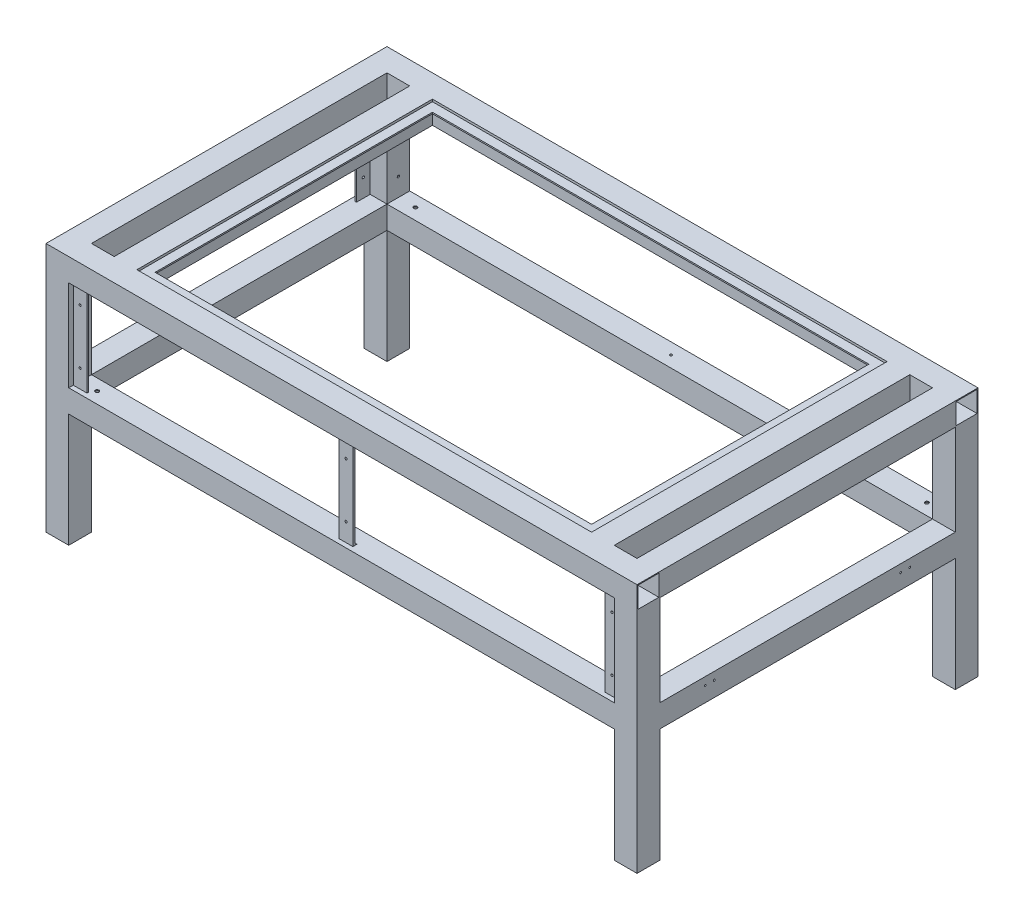
from build123d import *

# Parameters (mm, degrees)
ESQUISSE1_W                = 1300
ESQUISSE1_H                = 750
ESQUISSE1_W_2              = 1200
ESQUISSE1_H_2              = 650
BOSS_EXTRU_1_DEPTH         = 550
ESQUISSE2_W                = 1200
ESQUISSE2_H                = 200
ESQUISSE2_H_2              = 250
ENL_V_MAT_EXTRU_1_DEPTH    = 1599.436736315
ESQUISSE3_W                = 650
ESQUISSE3_H                = 200
ESQUISSE3_H_2              = 250
ENL_V_MAT_EXTRU_2_DEPTH    = 1599.436736315
ESQUISSE4_W                = 50
ESQUISSE4_H                = 650
BOSS_EXTRU_2_DEPTH         = 50
BOSS_EXTRU_2_2_DEPTH       = 50
ESQUISSE18_R               = 4
ENL_V_MAT_EXTRU_5_DEPTH    = 80
ESQUISSE19_R               = 15
ENL_V_MAT_EXTRU_6_DEPTH    = 48
ESQUISSE20_W               = 46
ESQUISSE20_H               = 46
ENL_V_MAT_EXTRU_7_DEPTH    = 10000
ESQUISSE21_W               = 46
ESQUISSE21_H               = 46
ENL_V_MAT_EXTRU_8_DEPTH    = 500
ESQUISSE22_W               = 30
ESQUISSE22_H               = 200
BOSS_EXTRU_11_DEPTH        = 3
ESQUISSE23_W               = 30
ESQUISSE23_H               = 200
ESQUISSE23_R               = 2.5
BOSS_EXTRU_12_DEPTH        = 3
ESQUISSE25_W               = 1000
ESQUISSE25_H               = 20
BOSS_EXTRU_14_DEPTH        = 3
ESQUISSE26_W               = 1000
ESQUISSE26_H               = 20
BOSS_EXTRU_15_DEPTH        = 3
ESQUISSE27_W               = 650
ESQUISSE27_H               = 20
BOSS_EXTRU_16_DEPTH        = 3
ESQUISSE28_W               = 20
ESQUISSE28_H               = 650
BOSS_EXTRU_17_DEPTH        = 3
ESQUISSE29_R               = 2.5
ENL_V_MAT_EXTRU_9_DEPTH    = 10
ESQUISSE30_R               = 2.5
ENL_V_MAT_EXTRU_10_DEPTH   = 15
ESQUISSE31_W               = 30
ESQUISSE31_H               = 5
BOSS_EXTRU_18_DEPTH        = 200
CONG_1_R                   = 5
ESQUISSE32_R               = 2.5
ENL_V_MAT_EXTRU_11_DEPTH   = 5
SYM_TRIE15_COPY_1_SKETCH_W = 30
SYM_TRIE15_COPY_1_SKETCH_H = 200
SYM_TRIE15_COPY_1_DEPTH    = 3
SYM_TRIE15_COPY_2_SKETCH_W = 30
SYM_TRIE15_COPY_2_SKETCH_H = 200
SYM_TRIE15_COPY_2_SKETCH_R = 2.5
SYM_TRIE15_COPY_2_DEPTH    = 3
SYM_TRIE15_COPY_3_SKETCH_W = 30
SYM_TRIE15_COPY_3_SKETCH_H = 200
SYM_TRIE15_COPY_3_DEPTH    = 3
SYM_TRIE15_COPY_4_SKETCH_W = 30
SYM_TRIE15_COPY_4_SKETCH_H = 200
SYM_TRIE15_COPY_4_SKETCH_R = 2.5
SYM_TRIE15_COPY_4_DEPTH    = 3
ESQUISSE33_W               = 80.648964208
ESQUISSE33_H               = 200
ENL_V_MAT_EXTRU_12_DEPTH   = 78
ESQUISSE34_R               = 2
ENL_V_MAT_EXTRU_13_DEPTH   = 25


with BuildPart() as part:
    # Esquisse1 → Boss.-Extru.1 (new body)
    with BuildSketch(Plane(origin=(0, 0, 0), x_dir=(1, 0, 0), z_dir=(0, 1, 0))):
        with Locations((650, 375)):
            Rectangle(ESQUISSE1_W, ESQUISSE1_H)
        with Locations((650, 375)):
            Rectangle(ESQUISSE1_W_2, ESQUISSE1_H_2, mode=Mode.SUBTRACT)
    extrude(amount=-BOSS_EXTRU_1_DEPTH)

    # Esquisse2 → Enlèv. mat.-Extru.1 (cut, through all)
    with BuildSketch(Plane.XY):
        with Locations((650, -150)):
            Rectangle(ESQUISSE2_W, ESQUISSE2_H)
        with Locations((650, -425)):
            Rectangle(ESQUISSE2_W, ESQUISSE2_H_2)
    extrude(amount=-ENL_V_MAT_EXTRU_1_DEPTH, mode=Mode.SUBTRACT)

    # Esquisse3 → Enlèv. mat.-Extru.2 (cut, through all)
    with BuildSketch(Plane.ZY):
        with Locations((-375, -150)):
            Rectangle(ESQUISSE3_W, ESQUISSE3_H)
        with Locations((-375, -425)):
            Rectangle(ESQUISSE3_W, ESQUISSE3_H_2)
    extrude(amount=-ENL_V_MAT_EXTRU_2_DEPTH, mode=Mode.SUBTRACT)

    # Esquisse18 → Enlèv. mat.-Extru.5 (cut)
    with BuildSketch(Plane(origin=(0, -250, 0), x_dir=(1, 0, 0), z_dir=(0, 1, 0))):
        with Locations((1212.5, 25)):
            Circle(ESQUISSE18_R)
        with Locations((87.5, 25)):
            Circle(ESQUISSE18_R)
        with Locations((87.5, 725)):
            Circle(ESQUISSE18_R)
        with Locations((1212.5, 725)):
            Circle(ESQUISSE18_R)
    extrude(amount=-ENL_V_MAT_EXTRU_5_DEPTH, mode=Mode.SUBTRACT)

    # Esquisse19 → Enlèv. mat.-Extru.6 (cut)
    with BuildSketch(Plane(origin=(0, -300, 0), x_dir=(-1, 0, 0), z_dir=(0, -1, 0))):
        with Locations((-1212.5, 725)):
            Circle(ESQUISSE19_R)
        with Locations((-87.5, 725)):
            Circle(ESQUISSE19_R)
        with Locations((-87.5, 25)):
            Circle(ESQUISSE19_R)
        with Locations((-1212.5, 25)):
            Circle(ESQUISSE19_R)
    extrude(amount=-ENL_V_MAT_EXTRU_6_DEPTH, mode=Mode.SUBTRACT)

    # Esquisse20 → Enlèv. mat.-Extru.7 (cut)
    with BuildSketch(Plane.ZY):
        with Locations((-25, -25)):
            Rectangle(ESQUISSE20_W, ESQUISSE20_H)
        with Locations((-725, -25)):
            Rectangle(ESQUISSE20_W, ESQUISSE20_H)
    extrude(amount=-ENL_V_MAT_EXTRU_7_DEPTH, mode=Mode.SUBTRACT)

    # Esquisse21 → Enlèv. mat.-Extru.8 (cut)
    with BuildSketch(Plane(origin=(0, -550, 0), x_dir=(-1, 0, 0), z_dir=(0, -1, 0))):
        with Locations((-1275, 25)):
            Rectangle(ESQUISSE21_W, ESQUISSE21_H)
        with Locations((-1275, 725)):
            Rectangle(ESQUISSE21_W, ESQUISSE21_H)
        with Locations((-25, 725)):
            Rectangle(ESQUISSE21_W, ESQUISSE21_H)
        with Locations((-25, 25)):
            Rectangle(ESQUISSE21_W, ESQUISSE21_H)
    extrude(amount=-ENL_V_MAT_EXTRU_8_DEPTH, mode=Mode.SUBTRACT)

    # Esquisse22 → Boss.-Extru.11 (add)
    with BuildSketch(Plane(origin=(0, 0, -50), x_dir=(-1, 0, 0), z_dir=(0, 0, -1))):
        with Locations((-25, -150)):
            Rectangle(ESQUISSE22_W, ESQUISSE22_H)
    boss_extru_11 = extrude(amount=BOSS_EXTRU_11_DEPTH)

    # Esquisse23 → Boss.-Extru.12 (add)
    with BuildSketch(Plane.ZY.offset(-10)):
        with Locations((-65, -150)):
            Rectangle(ESQUISSE23_W, ESQUISSE23_H)
        with Locations((-65, -90)):
            Circle(ESQUISSE23_R, mode=Mode.SUBTRACT)
        with Locations((-65, -210)):
            Circle(ESQUISSE23_R, mode=Mode.SUBTRACT)
    boss_extru_12 = extrude(amount=-BOSS_EXTRU_12_DEPTH)

    # Symétrie3: Boss.-Extru.11, Boss.-Extru.12 across plane
    add(boss_extru_11.mirror(Plane(origin=(0, 0, 0), x_dir=(-0.7071067811865475, 0, 0.7071067811865477), z_dir=(-0.7071067811865476, 0, -0.7071067811865475))))
    add(boss_extru_12.mirror(Plane(origin=(0, 0, 0), x_dir=(-0.7071067811865475, 0, 0.7071067811865477), z_dir=(-0.7071067811865476, 0, -0.7071067811865475))))



with BuildPart() as body_2:
    # Esquisse4 → Boss.-Extru.2 (new body)
    with BuildSketch(Plane(origin=(0, 0, 0), x_dir=(1, 0, 0), z_dir=(0, 1, 0))):
        with Locations((125, 375)):
            Rectangle(ESQUISSE4_W, ESQUISSE4_H)
    extrude(amount=-BOSS_EXTRU_2_DEPTH)


with BuildPart() as body_3:
    # Esquisse4 → Boss.-Extru.2 2 (new body)
    with BuildSketch(Plane(origin=(0, 0, 0), x_dir=(1, 0, 0), z_dir=(0, 1, 0))):
        with Locations((1175, 375)):
            Rectangle(ESQUISSE4_W, ESQUISSE4_H)
    extrude(amount=-BOSS_EXTRU_2_2_DEPTH)


with BuildPart() as part_1:
    add(part.part)

    add(body_2.part)  # Boss.-Extru.14 merges body 2

    add(body_3.part)  # Boss.-Extru.14 merges body 3
    # Esquisse25 → Boss.-Extru.14 (add)
    with BuildSketch(Plane(origin=(0, 0, -50), x_dir=(-1, 0, 0), z_dir=(0, 0, -1))):
        with Locations((-650, -15)):
            Rectangle(ESQUISSE25_W, ESQUISSE25_H)
    boss_extru_14 = extrude(amount=BOSS_EXTRU_14_DEPTH)

    # Esquisse26 → Boss.-Extru.15 (add)
    with BuildSketch(Plane(origin=(0, -5, 0), x_dir=(1, 0, 0), z_dir=(0, 1, 0))):
        with Locations((650, 60)):
            Rectangle(ESQUISSE26_W, ESQUISSE26_H)
    boss_extru_15 = extrude(amount=-BOSS_EXTRU_15_DEPTH)

    # Symétrie6: Boss.-Extru.14, Boss.-Extru.15 across plane
    add(boss_extru_14.mirror(Plane.XY.offset(-375)))
    add(boss_extru_15.mirror(Plane.XY.offset(-375)))

    # Esquisse27 → Boss.-Extru.16 (add)
    with BuildSketch(Plane.ZY.offset(-1150)):
        with Locations((-375, -15)):
            Rectangle(ESQUISSE27_W, ESQUISSE27_H)
    boss_extru_16 = extrude(amount=BOSS_EXTRU_16_DEPTH)

    # Esquisse28 → Boss.-Extru.17 (add)
    with BuildSketch(Plane(origin=(0, -5, 0), x_dir=(1, 0, 0), z_dir=(0, 1, 0))):
        with Locations((1140, 375)):
            Rectangle(ESQUISSE28_W, ESQUISSE28_H)
    boss_extru_17 = extrude(amount=-BOSS_EXTRU_17_DEPTH)

    # Symétrie7: Boss.-Extru.16, Boss.-Extru.17 across plane
    add(boss_extru_16.mirror(Plane.ZY.offset(-650)))
    add(boss_extru_17.mirror(Plane.ZY.offset(-650)))

    # Esquisse29 → Enlèv. mat.-Extru.9 (cut)
    with BuildSketch(Plane.ZY.offset(-1250)):
        with Locations((-725, -210)):
            Circle(ESQUISSE29_R)
        with Locations((-725, -90)):
            Circle(ESQUISSE29_R)
    enl_v_mat_extru_9 = extrude(amount=-ENL_V_MAT_EXTRU_9_DEPTH, mode=Mode.SUBTRACT)

    # Symétrie9: Enlèv. mat.-Extru.9 across plane
    add(enl_v_mat_extru_9.mirror(Plane.ZY.offset(-650)), mode=Mode.SUBTRACT)

    # Esquisse30 → Enlèv. mat.-Extru.10 (cut)
    with BuildSketch(Plane(origin=(0, -250, 0), x_dir=(1, 0, 0), z_dir=(0, 1, 0))):
        with Locations((650, 725)):
            Circle(ESQUISSE30_R)
    enl_v_mat_extru_10 = extrude(amount=-ENL_V_MAT_EXTRU_10_DEPTH, mode=Mode.SUBTRACT)

    # Symétrie10: Enlèv. mat.-Extru.10 across plane
    add(enl_v_mat_extru_10.mirror(Plane(origin=(0, -150, 0), x_dir=(0, 0, 1), z_dir=(0, -1, 0))), mode=Mode.SUBTRACT)

    # Esquisse31 → Boss.-Extru.18 (add)
    with BuildSketch(Plane(origin=(0, -250, 0), x_dir=(1, 0, 0), z_dir=(0, 1, 0))):
        with Locations((650, 12.5)):
            Rectangle(ESQUISSE31_W, ESQUISSE31_H)
    extrude(amount=BOSS_EXTRU_18_DEPTH)

    # Congé1
    cong_1_edges = [part_1.edges().sort_by_distance(p)[0] for p in [
        (650, -250, -15),
        (650, -50, -15),
    ]]
    fillet(cong_1_edges, radius=CONG_1_R)

    # Esquisse32 → Enlèv. mat.-Extru.11 (cut)
    with BuildSketch(Plane.XY.offset(-10)):
        with Locations((650, -210)):
            Circle(ESQUISSE32_R)
        with Locations((650, -90)):
            Circle(ESQUISSE32_R)
    extrude(amount=-ENL_V_MAT_EXTRU_11_DEPTH, mode=Mode.SUBTRACT)

    # Symétrie11: Boss.-Extru.12 across plane
    add(boss_extru_12.mirror(Plane.XY.offset(-375)))

    # Symétrie15 copy 1 sketch → Symétrie15 copy 1 (add)
    with BuildSketch(Plane.ZY.offset(-1250)):
        with Locations((-25, -150)):
            Rectangle(SYM_TRIE15_COPY_1_SKETCH_W, SYM_TRIE15_COPY_1_SKETCH_H)
    extrude(amount=SYM_TRIE15_COPY_1_DEPTH)

    # Symétrie15 copy 2 sketch → Symétrie15 copy 2 (add)
    with BuildSketch(Plane(origin=(1300, 0, -10), x_dir=(1, 0, 0), z_dir=(0, 0, 1))):
        with Locations((-65, -150)):
            Rectangle(SYM_TRIE15_COPY_2_SKETCH_W, SYM_TRIE15_COPY_2_SKETCH_H)
        with Locations((-65, -90)):
            Circle(SYM_TRIE15_COPY_2_SKETCH_R, mode=Mode.SUBTRACT)
        with Locations((-65, -210)):
            Circle(SYM_TRIE15_COPY_2_SKETCH_R, mode=Mode.SUBTRACT)
    extrude(amount=-SYM_TRIE15_COPY_2_DEPTH)

    # Symétrie15 copy 3 sketch → Symétrie15 copy 3 (add)
    with BuildSketch(Plane(origin=(1300, 0, -50), x_dir=(1, 0, 0), z_dir=(0, 0, -1))):
        with Locations((-25, 150)):
            Rectangle(SYM_TRIE15_COPY_3_SKETCH_W, SYM_TRIE15_COPY_3_SKETCH_H)
    extrude(amount=SYM_TRIE15_COPY_3_DEPTH)

    # Symétrie15 copy 4 sketch → Symétrie15 copy 4 (add)
    with BuildSketch(Plane(origin=(1290, 0, 0), x_dir=(0, 0, 1), z_dir=(1, 0, 0))):
        with Locations((-65, 150)):
            Rectangle(SYM_TRIE15_COPY_4_SKETCH_W, SYM_TRIE15_COPY_4_SKETCH_H)
        with Locations((-65, 90)):
            Circle(SYM_TRIE15_COPY_4_SKETCH_R, mode=Mode.SUBTRACT)
        with Locations((-65, 210)):
            Circle(SYM_TRIE15_COPY_4_SKETCH_R, mode=Mode.SUBTRACT)
    extrude(amount=-SYM_TRIE15_COPY_4_DEPTH)

    # Esquisse33 → Enlèv. mat.-Extru.12 (cut)
    with BuildSketch(Plane(origin=(1300, 0, 0), x_dir=(0, 0, -1), z_dir=(1, 0, 0))):
        with Locations((90.324482104, -150)):
            Rectangle(ESQUISSE33_W, ESQUISSE33_H)
    extrude(amount=-ENL_V_MAT_EXTRU_12_DEPTH, mode=Mode.SUBTRACT)

    # Esquisse34 → Enlèv. mat.-Extru.13 (cut)
    with BuildSketch(Plane(origin=(1300, 0, 0), x_dir=(0, 0, -1), z_dir=(1, 0, 0))):
        with Locations((150, -267)):
            Circle(ESQUISSE34_R)
        with Locations((170, -267)):
            Circle(ESQUISSE34_R)
    enl_v_mat_extru_13 = extrude(amount=-ENL_V_MAT_EXTRU_13_DEPTH, mode=Mode.SUBTRACT)

    # Symétrie16: Enlèv. mat.-Extru.13 across plane
    add(enl_v_mat_extru_13.mirror(Plane.XY.offset(-375)), mode=Mode.SUBTRACT)


solid = part_1.part
